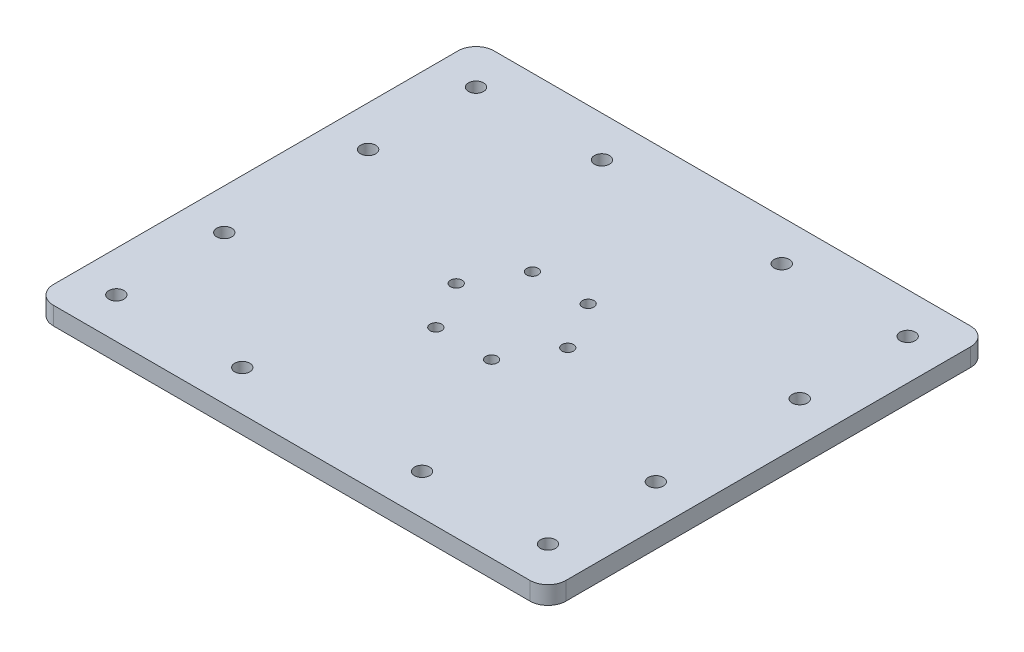
from build123d import *

# Parameters (mm, degrees)
SKETCH1_R          = 4.2
SKETCH1_R_2        = 3.2
BASE_FLANGE1_DEPTH = 10


# Sheet-metal steps are written as plain solids
with BuildPart() as part:
    # Sketch1 → Base-Flange1 (new body)
    with BuildSketch(Plane(origin=(0, 0, 0), x_dir=(1, 0, 0), z_dir=(0, 1, 0))):
        with BuildLine():
            Line((-132.5, 122.5), (132.5, 122.5))
            ThreePointArc((132.5, 122.5), (139.571067812, 119.571067812), (142.5, 112.5))
            Line((142.5, 112.5), (142.5, -112.5))
            ThreePointArc((142.5, -112.5), (139.571067812, -119.571067812), (132.5, -122.5))
            Line((132.5, -122.5), (-132.5, -122.5))
            ThreePointArc((-132.5, -122.5), (-139.571067812, -119.571067812), (-142.5, -112.5))
            Line((-142.5, -112.5), (-142.5, 112.5))
            ThreePointArc((-142.5, 112.5), (-139.571067812, 119.571067812), (-132.5, 122.5))
        make_face()
        with Locations(Location((120, 40, 0), (0, 0, 270))):
            Circle(SKETCH1_R, mode=Mode.SUBTRACT)
        with Locations(Location((120, -40, 0), (0, 0, 270))):
            Circle(SKETCH1_R, mode=Mode.SUBTRACT)
        with Locations(Location((-120, 40, 0), (0, 0, 270))):
            Circle(SKETCH1_R, mode=Mode.SUBTRACT)
        with Locations(Location((-120, -40, 0), (0, 0, 270))):
            Circle(SKETCH1_R, mode=Mode.SUBTRACT)
        with Locations(Location((-120, 100, 0), (0, 0, 270))):
            Circle(SKETCH1_R, mode=Mode.SUBTRACT)
        with Locations(Location((-50, 100, 0), (0, 0, 270))):
            Circle(SKETCH1_R, mode=Mode.SUBTRACT)
        with Locations(Location((50, 100, 0), (0, 0, 270))):
            Circle(SKETCH1_R, mode=Mode.SUBTRACT)
        with Locations(Location((120, 100, 0), (0, 0, 270))):
            Circle(SKETCH1_R, mode=Mode.SUBTRACT)
        with Locations(Location((120, -100, 0), (0, 0, 270))):
            Circle(SKETCH1_R, mode=Mode.SUBTRACT)
        with Locations(Location((50, -100, 0), (0, 0, 270))):
            Circle(SKETCH1_R, mode=Mode.SUBTRACT)
        with Locations(Location((-50, -100, 0), (0, 0, 270))):
            Circle(SKETCH1_R, mode=Mode.SUBTRACT)
        with Locations(Location((-120, -100, 0), (0, 0, 270))):
            Circle(SKETCH1_R, mode=Mode.SUBTRACT)
        with Locations(Location((31, 0, 0), (0, 0, 270))):
            Circle(SKETCH1_R_2, mode=Mode.SUBTRACT)
        with Locations(Location((15.5, -26.846787517, 0), (0, 0, 270))):
            Circle(SKETCH1_R_2, mode=Mode.SUBTRACT)
        with Locations(Location((-15.5, -26.846787517, 0), (0, 0, 270))):
            Circle(SKETCH1_R_2, mode=Mode.SUBTRACT)
        with Locations(Location((-31, 0, 0), (0, 0, 270))):
            Circle(SKETCH1_R_2, mode=Mode.SUBTRACT)
        with Locations(Location((-15.5, 26.846787517, 0), (0, 0, 270))):
            Circle(SKETCH1_R_2, mode=Mode.SUBTRACT)
        with Locations(Location((15.5, 26.846787517, 0), (0, 0, 270))):
            Circle(SKETCH1_R_2, mode=Mode.SUBTRACT)
    extrude(amount=-BASE_FLANGE1_DEPTH)


solid = part.part
